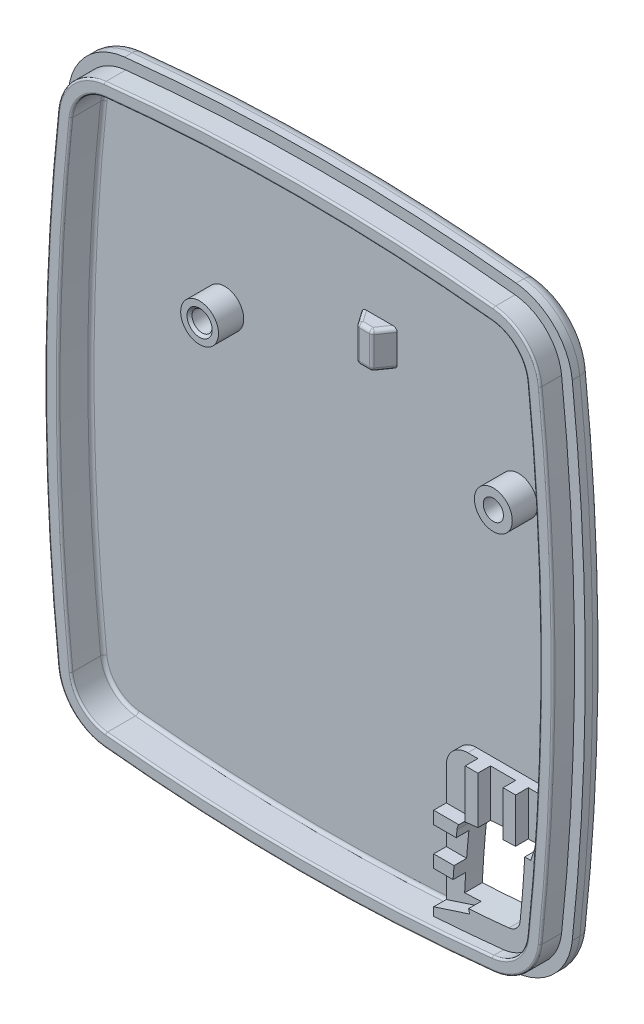
from build123d import *

# Parameters (mm, degrees)
IZIM1_W                           = 42
IZIM1_H                           = 49
Y_KSEKLIK_EKSTR_ZYON1_DEPTH       = 0.8
KES_EKSTR_ZYON1_DEPTH             = 33.308048533
KES_EKSTR_ZYON2_DEPTH             = 33.308048533
RADYUS1_R                         = 5
RADYUS2_R                         = 1
BO_ALTMA1_T                       = -0.7
Y_KSEKLIK_EKSTR_ZYON10_DEPTH      = 1.7
Y_KSEKLIK_EKSTR_ZYON10_DEPTH_BACK = 0.9
KES_EKSTR_ZYON5_DEPTH             = 1.7
RADYUS3_R                         = 0.15
IZIM14_R                          = 1.5
IZIM14_R_2                        = 0.8
Y_KSEKLIK_EKSTR_ZYON13_DEPTH      = 2
RADYUS6_R                         = 0.25
Y_KSEKLIK_EKSTR_ZYON15_DEPTH      = 1.1
Y_KSEKLIK_EKSTR_ZYON15_DEPTH_BACK = 0.2
IZIM17_W                          = 3.777976332
IZIM17_H                          = 2.881557519
Y_KSEKLIK_EKSTR_ZYON16_DEPTH      = 2.4
KES_EKSTR_ZYON3_DEPTH             = 10.4
KES_EKSTR_ZYON3_DEPTH_BACK        = 1.5
Y_KSEKLIK_EKSTR_ZYON18_OUTLINE_W  = 4.462087673
Y_KSEKLIK_EKSTR_ZYON18_OUTLINE_H  = 1.556542211
Y_KSEKLIK_EKSTR_ZYON18_DEPTH      = 0.4
Y_KSEKLIK_EKSTR_ZYON19_START      = -1.435
Y_KSEKLIK_EKSTR_ZYON19_OUTLINE_R  = 0.75
Y_KSEKLIK_EKSTR_ZYON19_DEPTH      = 0.635
RADYUS9_R                         = 0.6
PAH1_SIZE                         = 0.2
PAH2_SIZE                         = 1.9
PAH2_SIZE_2                       = 1.330394323
RADYUS10_R                        = 0.3
RADYUS11_R                        = 1.7
IZIM32_W                          = 3
IZIM32_H                          = 2
IZIM32_W_2                        = 2
IZIM32_H_2                        = 4
IZIM32_W_3                        = 2.812041531
IZIM32_H_3                        = 5.210730246
KES_EKSTR_ZYON6_DEPTH             = 1
Y_KSEKLIK_EKSTR_ZYON22_DEPTH      = 0.1
Y_KSEKLIK_EKSTR_ZYON22_DEPTH_BACK = 0.2
IZIM33_R                          = 4
IZIM34_R                          = 0.763160631
Y_KSEKLIK_EKSTR_ZYON23_DEPTH      = 0.2


# Read off the part's stored shape, not the designer's step: Yükseklik-Ekstrüzyon18, Yükseklik-Ekstrüzyon19
with BuildPart() as part:
    # Çizim1 → Yükseklik-Ekstrüzyon1 (new, symmetric)
    with BuildSketch(Plane.XY):
        Rectangle(IZIM1_W, IZIM1_H)
    extrude(amount=Y_KSEKLIK_EKSTR_ZYON1_DEPTH, both=True)

    # Çizim2 → Kes-Ekstrüzyon1 (cut, through all)
    with BuildSketch(Plane.XY.offset(0.8)):
        with BuildLine():
            Line((21, 24.5), (0, 24.5))
            ThreePointArc((0, 24.5), (10.526751636, 24.1245229), (21, 23))
            Line((21, 23), (21, 24.5))
        make_face()
        with BuildLine():
            Line((0, 24.5), (-21, 24.5))
            Line((-21, 24.5), (-21, 23))
            ThreePointArc((-21, 23), (-10.526751636, 24.1245229), (0, 24.5))
        make_face()
        with BuildLine():
            ThreePointArc((0, -24.5), (-10.526751636, -24.1245229), (-21, -23))
            Line((-21, -23), (-21, -24.5))
            Line((-21, -24.5), (0, -24.5))
        make_face()
        with BuildLine():
            Line((21, -24.5), (21, -23))
            ThreePointArc((21, -23), (10.526751636, -24.1245229), (0, -24.5))
            Line((0, -24.5), (21, -24.5))
        make_face()
    extrude(amount=-KES_EKSTR_ZYON1_DEPTH, mode=Mode.SUBTRACT)

    # Çizim3 → Kes-Ekstrüzyon2 (cut, through all)
    with BuildSketch(Plane.XY.offset(0.8)):
        with BuildLine():
            Line((21, -4.8e-07), (21, 23))
            ThreePointArc((21, 23), (20.250265893, 23.105694222), (19.5, 23.207545043))
            ThreePointArc((19.5, 23.207545043), (20.624609184, 11.627984828), (21, -4.8e-07))
        make_face()
        with BuildLine():
            Line((21, -23), (21, -4.8e-07))
            ThreePointArc((21, -4.8e-07), (20.624609153, -11.627985307), (19.5, -23.207545043))
            ThreePointArc((19.5, -23.207545043), (20.250265893, -23.105694222), (21, -23))
        make_face()
        with BuildLine():
            ThreePointArc((-21, -23), (-20.250265893, -23.105694222), (-19.5, -23.207545043))
            ThreePointArc((-19.5, -23.207545043), (-20.624609193, -11.62798468), (-21, 7.77e-07))
            Line((-21, 7.77e-07), (-21, -23))
        make_face()
        with BuildLine():
            ThreePointArc((-21, 7.77e-07), (-20.624609143, 11.627985455), (-19.5, 23.207545043))
            ThreePointArc((-19.5, 23.207545043), (-20.250265893, 23.105694222), (-21, 23))
            Line((-21, 23), (-21, 7.77e-07))
        make_face()
    extrude(amount=-KES_EKSTR_ZYON2_DEPTH, mode=Mode.SUBTRACT)

    # Radyus1
    radyus1_edges = [part.edges().sort_by_distance(p)[0] for p in [
        (19.5, 23.207545043, 0),
        (19.5, -23.207545043, 0),
        (-19.5, -23.207545043, 0),
        (-19.5, 23.207545043, 0),
    ]]
    fillet(radyus1_edges, radius=RADYUS1_R)

    # Radyus2
    radyus2_edges = [part.edges().sort_by_distance(p)[0] for p in [
        (-21, 0, -0.8),
        (0, -24.5, -0.8),
        (0, 24.5, -0.8),
        (21, 0, -0.8),
        (18.53112444, 22.248381304, -0.8),
        (-18.53112444, 22.248381304, -0.8),
        (18.53112444, -22.248381304, -0.8),
        (-18.53112444, -22.248381304, -0.8),
    ]]
    fillet(radyus2_edges, radius=RADYUS2_R)

    # İç Boşaltma1
    bo_altma1_openings = [part.faces().sort_by_distance(p)[0] for p in [
        (0, 2.1e-08, 0.8),
    ]]
    offset(amount=BO_ALTMA1_T, openings=bo_altma1_openings)



with BuildPart() as body_2:
    # Çizim10 → Yükseklik-Ekstrüzyon10 (new, two sides: drawn at the far end of the back side and taken through both)
    with BuildSketch(Plane.XY.offset(0.8).offset(-Y_KSEKLIK_EKSTR_ZYON10_DEPTH_BACK)):
        with BuildLine():
            ThreePointArc((-19.274000395, -19.168866518), (-18.036566497, -21.752990104), (-15.450363437, -22.986072054))
            ThreePointArc((-15.450363437, -22.986072054), (0, -23.8), (15.450363437, -22.986072054))
            ThreePointArc((15.450363437, -22.986072054), (18.036566497, -21.752990104), (19.274000395, -19.168866518))
            ThreePointArc((19.274000395, -19.168866518), (20.3, 0), (19.274000395, 19.168866518))
            ThreePointArc((19.274000395, 19.168866518), (18.036566497, 21.752990104), (15.450363437, 22.986072054))
            ThreePointArc((15.450363437, 22.986072054), (0, 23.8), (-15.450363437, 22.986072054))
            ThreePointArc((-15.450363437, 22.986072054), (-18.036566497, 21.752990104), (-19.274000395, 19.168866518))
            ThreePointArc((-19.274000395, 19.168866518), (-20.3, 0), (-19.274000395, -19.168866518))
        make_face()
        with BuildLine():
            ThreePointArc((15.324280906, 21.792714104), (0, 22.6), (-15.324280906, 21.792714104))
            ThreePointArc((-15.324280906, 21.792714104), (-17.18875288, 20.903748048), (-18.080856387, 19.04077523))
            ThreePointArc((-18.080856387, 19.04077523), (-19.1, 0), (-18.080856387, -19.04077523))
            ThreePointArc((-18.080856387, -19.04077523), (-17.18875288, -20.903748048), (-15.324280906, -21.792714104))
            ThreePointArc((-15.324280906, -21.792714104), (0, -22.6), (15.324280906, -21.792714104))
            ThreePointArc((15.324280906, -21.792714104), (17.18875288, -20.903748048), (18.080856387, -19.04077523))
            ThreePointArc((18.080856387, -19.04077523), (19.1, 0), (18.080856387, 19.04077523))
            ThreePointArc((18.080856387, 19.04077523), (17.18875288, 20.903748048), (15.324280906, 21.792714104))
        make_face(mode=Mode.SUBTRACT)
    extrude(amount=Y_KSEKLIK_EKSTR_ZYON10_DEPTH + Y_KSEKLIK_EKSTR_ZYON10_DEPTH_BACK)

    # Çizim13 → Kes-Ekstrüzyon5 (cut)
    with BuildSketch(Plane.XY.offset(2.5)):
        with BuildLine():
            ThreePointArc((-19.274000395, 19.168866518), (-20.3, 0), (-19.274000395, -19.168866518))
            ThreePointArc((-19.274000395, -19.168866518), (-18.036566497, -21.752990104), (-15.450363437, -22.986072054))
            ThreePointArc((-15.450363437, -22.986072054), (0, -23.8), (15.450363437, -22.986072054))
            ThreePointArc((15.450363437, -22.986072054), (18.036566497, -21.752990104), (19.274000395, -19.168866518))
            ThreePointArc((19.274000395, -19.168866518), (20.3, 0), (19.274000395, 19.168866518))
            ThreePointArc((19.274000395, 19.168866518), (18.036566497, 21.752990104), (15.450363437, 22.986072054))
            ThreePointArc((15.450363437, 22.986072054), (0, 23.8), (-15.450363437, 22.986072054))
            ThreePointArc((-15.450363437, 22.986072054), (-18.036566497, 21.752990104), (-19.274000395, 19.168866518))
        make_face()
        with BuildLine():
            ThreePointArc((15.434603121, 22.83690231), (0, 23.65), (-15.434603121, 22.83690231))
            ThreePointArc((-15.434603121, 22.83690231), (-17.930589795, 21.646834847), (-19.124857394, 19.152855107))
            ThreePointArc((-19.124857394, 19.152855107), (-20.15, 0), (-19.124857394, -19.152855107))
            ThreePointArc((-19.124857394, -19.152855107), (-17.930589795, -21.646834847), (-15.434603121, -22.83690231))
            ThreePointArc((-15.434603121, -22.83690231), (0, -23.65), (15.434603121, -22.83690231))
            ThreePointArc((15.434603121, -22.83690231), (17.930589795, -21.646834847), (19.124857394, -19.152855107))
            ThreePointArc((19.124857394, -19.152855107), (20.15, 0), (19.124857394, 19.152855107))
            ThreePointArc((19.124857394, 19.152855107), (17.930589795, 21.646834847), (15.434603121, 22.83690231))
        make_face(mode=Mode.SUBTRACT)
    extrude(amount=-KES_EKSTR_ZYON5_DEPTH, mode=Mode.SUBTRACT)

    # Radyus3
    radyus3_edges = [body_2.edges().sort_by_distance(p)[0] for p in [
        (17.18875288, 20.903748048, 2.5),
        (0, 22.6, 2.5),
        (-17.18875288, 20.903748048, 2.5),
        (-19.1, 0, 2.5),
        (-17.18875288, -20.903748048, 2.5),
        (0, -22.6, 2.5),
        (17.18875288, -20.903748048, 2.5),
        (19.1, 0, 2.5),
        (17.930589795, 21.646834847, 2.5),
        (20.15, 0, 2.5),
        (17.930589795, -21.646834847, 2.5),
        (0, -23.65, 2.5),
        (-17.930589795, -21.646834847, 2.5),
        (-20.15, 0, 2.5),
        (-17.930589795, 21.646834847, 2.5),
        (0, 23.65, 2.5),
    ]]
    fillet(radyus3_edges, radius=RADYUS3_R)


with BuildPart() as part_1:
    add(part.part)

    add(body_2.part)  # Yükseklik-Ekstrüzyon13 merges body 2
    # Çizim14 → Yükseklik-Ekstrüzyon13 (add)
    # profile 1 of 2: a face of its own
    with BuildSketch(Plane.XY.offset(-0.1)):
        with Locations(Location((-8.481909678, 9.50887969, 0), (0, 0, 180))):
            Circle(IZIM14_R)
        with Locations((-8.481909678, 9.50887969)):
            Circle(IZIM14_R_2, mode=Mode.SUBTRACT)
    # profile 2 of 2: a face of its own
    with BuildSketch(Plane.XY.offset(-0.1)):
        with Locations(Location((14.811265156, 8.310003034, 0), (0, 0, 180))):
            Circle(IZIM14_R)
        with Locations((14.811265156, 8.310003034)):
            Circle(IZIM14_R_2, mode=Mode.SUBTRACT)
    extrude(amount=Y_KSEKLIK_EKSTR_ZYON13_DEPTH)

    # Radyus6
    radyus6_edges = [part_1.edges().sort_by_distance(p)[0] for p in [
        (19.1, 0, -0.1),
        (17.18875288, 20.903748048, -0.1),
        (0, 22.6, -0.1),
        (-17.18875288, 20.903748048, -0.1),
        (-19.1, 0, -0.1),
        (-17.18875288, -20.903748048, -0.1),
        (0, -22.6, -0.1),
        (17.18875288, -20.903748048, -0.1),
    ]]
    fillet(radyus6_edges, radius=RADYUS6_R)

    # Çizim20 → Yükseklik-Ekstrüzyon16 (add)
    with BuildSketch(Plane(origin=(0, 0, -0.8), x_dir=(-1, 0, 0), z_dir=(0, 0, -1))):
        Polygon((-18.929762461, -10.688381304), (-18.929762461, -16.972393135), (-18.321456915, -20.446835518), (-15.854602823, -22.35), (-9.78112444, -22.421993206), (-9.78112444, -10.688381304), align=None)
    extrude(amount=-Y_KSEKLIK_EKSTR_ZYON16_DEPTH)

    # Çizim11 → Kes-Ekstrüzyon3 (cut, two sides: drawn at the far end of the back side and taken through both)
    with BuildSketch(Plane.XY.offset(-0.1).offset(-KES_EKSTR_ZYON3_DEPTH_BACK)):
        with BuildLine():
            ThreePointArc((15.747267327, -20.08503533), (13.494386991, -20.292748653), (11.236115086, -20.429944269))
            ThreePointArc((11.236115086, -20.429944269), (11.398117376, -17.911625141), (11.631741678, -15.398938201))
            ThreePointArc((11.631741678, -15.398938201), (11.919517003, -14.797979227), (12.520959575, -14.511215983))
            ThreePointArc((12.520959575, -14.511215983), (14.766772487, -14.309259149), (17.017786728, -14.177361138))
            ThreePointArc((17.017786728, -14.177361138), (16.861729506, -16.689033908), (16.634435234, -19.195264399))
            ThreePointArc((16.634435234, -19.195264399), (16.34804685, -19.796885558), (15.747267327, -20.08503533))
        make_face()
    extrude(amount=KES_EKSTR_ZYON3_DEPTH + KES_EKSTR_ZYON3_DEPTH_BACK, mode=Mode.SUBTRACT)

    # Yükseklik-Ekstrüzyon18 outline → Yükseklik-Ekstrüzyon18 (add)
    # profile 1 of 9: a face of its own
    with BuildSketch(Plane(origin=(0, 0, -0.8), x_dir=(-1, 0, 0), z_dir=(0, 0, -1))):
        with BuildLine():
            add(Edge.make_bspline(
                [(12.118367005, -9.482808521), (12.091880497, -9.48291382), (12.041867707, -9.48311265), (11.970803059, -9.485904145), (11.90831427, -9.488622522), (11.853948015, -9.493540095), (11.808151869, -9.499658497), (11.770372058, -9.507510039), (11.740978928, -9.517024279), (11.712578237, -9.530538402), (11.686317962, -9.555004828), (11.666544013, -9.593198708), (11.652900211, -9.63890303), (11.651926387, -9.672393805), (11.651404341, -9.690347482)],
                knots=[0, 0, 0, 0, 0.135204718, 0.255298483, 0.3630462, 0.45447317, 0.533879273, 0.598821629, 0.651172559, 0.691275066, 0.758648293, 0.82966591, 0.908687594, 1, 1, 1, 1], degree=3))
            Line((12.118367005, -9.482808521), (13.623024476, -9.482808521))
            Line((13.623024476, -9.482808521), (13.623024476, -8.03003579))
            Line((13.623024476, -8.03003579), (12.419136359, -8.03003579))
            add(Edge.make_bspline(
                [(11.314964228, -8.788039419), (11.317062174, -8.75801293), (11.321118336, -8.699959799), (11.332397364, -8.61654582), (11.34780333, -8.539908247), (11.366699794, -8.469939251), (11.391285928, -8.407078258), (11.419641216, -8.350796065), (11.451733054, -8.300806663), (11.500226471, -8.246113688), (11.562419933, -8.190013261), (11.633993622, -8.133335083), (11.701789418, -8.091147069), (11.759689265, -8.068191793), (11.810748879, -8.056202575), (11.86066885, -8.049293804), (11.922964144, -8.044341352), (11.997757372, -8.038133057), (12.085368812, -8.034439426), (12.185645657, -8.032272406), (12.298337357, -8.03060783), (12.377519873, -8.030232863), (12.419136359, -8.03003579)],
                knots=[0, 0, 0, 0, 0.057749972, 0.111653638, 0.161384845, 0.207685759, 0.250539078, 0.290660311, 0.328487367, 0.364148125, 0.430567385, 0.488965629, 0.539213259, 0.583221344, 0.607748032, 0.639723137, 0.679817551, 0.727663726, 0.783729083, 0.848050361, 0.920138808, 1, 1, 1, 1], degree=3))
            add(Edge.make_bspline(
                [(10.39968498, -8.03003579), (10.440773487, -8.030408375), (10.519795704, -8.03112494), (10.63350644, -8.039166316), (10.737167124, -8.052863048), (10.831106831, -8.071002989), (10.914883838, -8.095367676), (10.989349707, -8.124212349), (11.054119041, -8.158744508), (11.108967073, -8.200458649), (11.156101222, -8.248145875), (11.195756356, -8.303608511), (11.231331966, -8.365411153), (11.258847184, -8.435943945), (11.282859633, -8.512980977), (11.299309701, -8.598095345), (11.310768625, -8.690469813), (11.313533397, -8.754765146), (11.314964228, -8.788039419)],
                knots=[0, 0, 0, 0, 0.089184998, 0.171522325, 0.247270212, 0.316068583, 0.379002164, 0.436410953, 0.489174977, 0.537748439, 0.58545333, 0.634147084, 0.685372273, 0.739840404, 0.798108953, 0.860349726, 0.927727859, 1, 1, 1, 1], degree=3))
            add(Edge.make_bspline(
                [(9.160936803, -10.224598168), (9.16102192, -10.14622951), (9.161185412, -9.995699972), (9.164367327, -9.779223143), (9.17006806, -9.581402536), (9.177392544, -9.402500776), (9.185483166, -9.242669918), (9.197973132, -9.101883377), (9.211505704, -8.979953432), (9.226265955, -8.873856856), (9.247412743, -8.779719274), (9.272634382, -8.691716217), (9.306479387, -8.609109055), (9.345195666, -8.53025376), (9.391966543, -8.456758077), (9.443604586, -8.386531754), (9.502433, -8.321580214), (9.5674802, -8.260836609), (9.640896268, -8.206531127), (9.722445144, -8.157904648), (9.813989746, -8.118614126), (9.914048869, -8.086673622), (10.022541054, -8.060076957), (10.140399524, -8.0433963), (10.267016795, -8.031234422), (10.354523141, -8.030443819), (10.39968498, -8.03003579)],
                knots=[0, 0, 0, 0, 0.079725817, 0.153136352, 0.220243204, 0.281049773, 0.335292386, 0.383031116, 0.424805529, 0.460108295, 0.491924878, 0.522891582, 0.553113479, 0.582620451, 0.612140226, 0.641611317, 0.671200139, 0.701159565, 0.732005221, 0.763924969, 0.797533254, 0.833090932, 0.870698054, 0.911016939, 0.954076031, 1, 1, 1, 1], degree=3))
            Line((9.160936803, -10.224598168), (9.160936803, -11.246889694))
            Line((9.160936803, -11.246889694), (13.623024476, -11.246889694))
            Line((13.623024476, -11.246889694), (13.623024476, -9.690347482))
            Line((13.623024476, -9.690347482), (11.651404341, -9.690347482))
        make_face()
        with BuildLine():
            add(Edge.make_bspline(
                [(10.281322916, -9.482808521), (10.252890403, -9.483457227), (10.201690983, -9.484625375), (10.132772311, -9.49551634), (10.07932982, -9.513206842), (10.04205633, -9.541992902), (10.019671149, -9.576122033), (10.002791352, -9.61151538), (9.992897811, -9.650097278), (9.991701049, -9.676781819), (9.991092649, -9.690347482)],
                knots=[0, 0, 0, 0, 0.207755591, 0.374112754, 0.509202691, 0.614768302, 0.711267723, 0.804995066, 0.900865026, 1, 1, 1, 1], degree=3))
            Line((10.281322916, -9.482808521), (10.525343335, -9.482808521))
            add(Edge.make_bspline(
                [(10.873133236, -9.690347482), (10.871018555, -9.664222954), (10.866911237, -9.613481602), (10.844355334, -9.558396387), (10.817560429, -9.528737079), (10.795758621, -9.516263115), (10.76747295, -9.505968169), (10.732453243, -9.497070431), (10.690312725, -9.491168265), (10.641361666, -9.486339131), (10.585650171, -9.482985998), (10.546156504, -9.482869772), (10.525343335, -9.482808521)],
                knots=[0, 0, 0, 0, 0.166092219, 0.322598885, 0.365047389, 0.417388159, 0.479796133, 0.555892735, 0.646094533, 0.749476332, 0.867973991, 1, 1, 1, 1], degree=3))
            Line((10.873133236, -9.690347482), (9.991092649, -9.690347482))
        make_face(mode=Mode.SUBTRACT)
    # profile 2 of 9: a face of its own
    with BuildSketch(Plane(origin=(0, 0, -0.8), x_dir=(-1, 0, 0), z_dir=(0, 0, -1))):
        with BuildLine():
            add(Edge.make_bspline(
                [(9.057167322, -4.246154217), (9.058794881, -4.174214953), (9.061972731, -4.033751699), (9.084727917, -3.82810577), (9.123605114, -3.633091274), (9.177259337, -3.449336151), (9.246150074, -3.279340213), (9.331884624, -3.126914738), (9.430773225, -2.991060154), (9.545672045, -2.876394153), (9.668807183, -2.781073251), (9.797565761, -2.705889353), (9.930608523, -2.651872362), (10.047760097, -2.626951796), (10.148276192, -2.616036395), (10.236115954, -2.607870573), (10.336377205, -2.600587666), (10.448825213, -2.595040181), (10.573431172, -2.591302336), (10.710435192, -2.587790656), (10.859889801, -2.586519799), (10.963661392, -2.586073701), (11.01743767, -2.585842525)],
                knots=[0, 0, 0, 0, 0.071156086, 0.138934077, 0.204360269, 0.267628769, 0.328042607, 0.385371601, 0.440225967, 0.493719081, 0.545369064, 0.59387776, 0.640786826, 0.686772042, 0.711805655, 0.740799195, 0.77403348, 0.811237386, 0.852158453, 0.897347383, 0.946803594, 1, 1, 1, 1], degree=3))
            add(Edge.make_bspline(
                [(11.01743767, -5.854581169), (10.96393053, -5.85439323), (10.860697281, -5.854030633), (10.712073473, -5.852185362), (10.575287493, -5.850578536), (10.45076099, -5.84481203), (10.338001896, -5.840768517), (10.237226272, -5.833914774), (10.148499129, -5.827090941), (10.046507317, -5.815652242), (9.928237128, -5.791875793), (9.794007293, -5.740475071), (9.665576791, -5.668747355), (9.54322794, -5.578068126), (9.430591777, -5.468032414), (9.331988531, -5.339092826), (9.247304429, -5.193676619), (9.177864525, -5.031596605), (9.123934819, -4.854251543), (9.085555601, -4.663112247), (9.061653942, -4.458890273), (9.058690448, -4.318374247), (9.057167322, -4.246154217)],
                knots=[0, 0, 0, 0, 0.053608009, 0.103427861, 0.148920116, 0.190646336, 0.228314806, 0.261956867, 0.291838231, 0.317461837, 0.364773927, 0.412243015, 0.460839878, 0.511740483, 0.564390982, 0.618057073, 0.673872393, 0.732566435, 0.794313299, 0.859251815, 0.92766065, 1, 1, 1, 1], degree=3))
            Line((11.01743767, -5.854581169), (11.766523609, -5.854581169))
            add(Edge.make_bspline(
                [(13.726793957, -4.246154217), (13.725427858, -4.315389373), (13.722752558, -4.450976079), (13.700827, -4.649021797), (13.663519017, -4.836434329), (13.612093138, -5.012231463), (13.546521097, -5.175435679), (13.463117367, -5.322235446), (13.365403152, -5.453634555), (13.252933191, -5.566498186), (13.130743791, -5.660804348), (13.001920323, -5.734456804), (12.868012333, -5.787603552), (12.750329866, -5.813591692), (12.648381874, -5.824397243), (12.559461893, -5.832507904), (12.45812258, -5.839837736), (12.344324862, -5.845418221), (12.21782576, -5.849111313), (12.078660171, -5.852624752), (11.926773823, -5.853910905), (11.821380829, -5.854351723), (11.766523609, -5.854581169)],
                knots=[0, 0, 0, 0, 0.069361909, 0.135834932, 0.199347161, 0.260608178, 0.319138762, 0.3751603, 0.429315834, 0.482735953, 0.534295463, 0.583532345, 0.630949374, 0.67811757, 0.703744355, 0.733652727, 0.767587554, 0.805543785, 0.847806793, 0.894393145, 0.945031466, 1, 1, 1, 1], degree=3))
            add(Edge.make_bspline(
                [(11.766523609, -2.585842525), (11.819219585, -2.586042329), (11.920830577, -2.5864276), (12.067298825, -2.588115462), (12.201892513, -2.590260114), (12.324600697, -2.594213816), (12.435662084, -2.600006051), (12.53512249, -2.606387215), (12.622759642, -2.613383674), (12.723670325, -2.624805652), (12.841162352, -2.648530495), (12.975090201, -2.700255944), (13.104073121, -2.772413308), (13.226969204, -2.865134973), (13.341923116, -2.976859684), (13.442500573, -3.109446462), (13.528743134, -3.260345828), (13.600616183, -3.428489225), (13.656659998, -3.612922199), (13.698078157, -3.811440857), (13.722440586, -4.024225494), (13.725313742, -4.170694925), (13.726793957, -4.246154217)],
                knots=[0, 0, 0, 0, 0.052107752, 0.100476752, 0.144841806, 0.185213496, 0.221869806, 0.254806787, 0.283766119, 0.308790412, 0.355224479, 0.401825094, 0.450152003, 0.500922991, 0.553643104, 0.608157733, 0.664900664, 0.725110244, 0.788586777, 0.855196428, 0.925398939, 1, 1, 1, 1], degree=3))
            Line((11.766523609, -2.585842525), (11.01743767, -2.585842525))
        make_face()
        with BuildLine():
            add(Edge.make_bspline(
                [(10.316182975, -4.142384737), (10.292400075, -4.142209018), (10.247529948, -4.141877497), (10.183770238, -4.144073992), (10.127266957, -4.145296381), (10.078074466, -4.147720205), (10.036134268, -4.150759589), (10.001879944, -4.155052587), (9.974277665, -4.158375113), (9.948818553, -4.165680505), (9.924490968, -4.176078587), (9.902914577, -4.193479969), (9.88939765, -4.216006875), (9.888024973, -4.232736644), (9.887323168, -4.241290023)],
                knots=[0, 0, 0, 0, 0.150823581, 0.284552058, 0.40457432, 0.509248844, 0.5969264, 0.671120842, 0.728325207, 0.772820751, 0.838778239, 0.894736625, 0.946182312, 1, 1, 1, 1], degree=3))
            Line((10.316182975, -4.142384737), (12.350226939, -4.142384737))
            add(Edge.make_bspline(
                [(12.896638111, -4.248586314), (12.895839192, -4.238882557), (12.894260269, -4.219704771), (12.876968515, -4.194576015), (12.849607834, -4.176516331), (12.819740395, -4.165580928), (12.787736288, -4.158298633), (12.753157315, -4.155101517), (12.709442354, -4.150671608), (12.655883458, -4.147760173), (12.592914909, -4.145294146), (12.520472748, -4.144057622), (12.43860381, -4.141883671), (12.380765109, -4.142211596), (12.350226939, -4.142384737)],
                knots=[0, 0, 0, 0, 0.048585199, 0.096020173, 0.148029396, 0.212566793, 0.256048555, 0.313918305, 0.388116605, 0.47858284, 0.585380571, 0.707180231, 0.84539452, 1, 1, 1, 1], degree=3))
            add(Edge.make_bspline(
                [(12.382654901, -4.298038958), (12.413191521, -4.298104734), (12.47102327, -4.298229304), (12.552637521, -4.297406255), (12.62399424, -4.295988741), (12.685050027, -4.293288229), (12.736161329, -4.291165726), (12.777283887, -4.288187098), (12.808407461, -4.284191263), (12.835318257, -4.279187337), (12.858923172, -4.272367114), (12.877526776, -4.262107065), (12.892147557, -4.257492556), (12.895457007, -4.250928832), (12.896638111, -4.248586314)],
                knots=[0, 0, 0, 0, 0.175019535, 0.331460592, 0.467794188, 0.58405049, 0.681738322, 0.760972023, 0.820335453, 0.861343311, 0.918167156, 0.959057849, 0.985388221, 1, 1, 1, 1], degree=3))
            Line((12.382654901, -4.298038958), (10.316182975, -4.298038958))
            add(Edge.make_bspline(
                [(9.887323168, -4.241290023), (9.888084427, -4.242424334), (9.890830804, -4.246516568), (9.900757498, -4.250778542), (9.914130766, -4.260429435), (9.929954352, -4.271063524), (9.950517881, -4.279345634), (9.976203444, -4.283011992), (10.01040172, -4.288314346), (10.053724042, -4.292143564), (10.106478524, -4.294001994), (10.168066844, -4.297011604), (10.239170175, -4.297118107), (10.289431284, -4.297719085), (10.316182975, -4.298038958)],
                knots=[0, 0, 0, 0, 0.009199604, 0.033189236, 0.070444793, 0.122518127, 0.162151234, 0.220247298, 0.298308526, 0.398089248, 0.515973477, 0.657754866, 0.817838549, 1, 1, 1, 1], degree=3))
        make_face(mode=Mode.SUBTRACT)
    # profile 3 of 9: a face of its own
    with BuildSketch(Plane(origin=(0, 0, -0.8), x_dir=(-1, 0, 0), z_dir=(0, 0, -1))):
        with BuildLine():
            add(Edge.make_bspline(
                [(9.160936803, -0.380971898), (9.238253616, -0.366263245), (9.395956951, -0.33626196), (9.636647883, -0.287419943), (9.887244369, -0.239801171), (10.057062969, -0.205490398), (10.143504074, -0.18802552)],
                knots=[0, 0, 0, 0, 0.23579309, 0.48094787, 0.735791961, 1, 1, 1, 1], degree=3))
            Line((9.160936803, -0.380971898), (9.160936803, -2.27638632))
            Line((9.160936803, -2.27638632), (13.623024476, -2.27638632))
            Line((13.623024476, -2.27638632), (13.623024476, -0.929815168))
            Line((13.623024476, -0.929815168), (10.732882297, -0.911979788))
            Line((10.732882297, -0.911979788), (13.623024476, -0.609589035))
            Line((13.623024476, -0.609589035), (13.623024476, 0.46539793))
            Line((13.623024476, 0.46539793), (10.680997556, 0.767788682))
            Line((10.680997556, 0.767788682), (13.623024476, 0.785624062))
            Line((13.623024476, 0.785624062), (13.623024476, 2.133816613))
            Line((13.623024476, 2.133816613), (9.160936803, 2.133816613))
            Line((9.160936803, 2.133816613), (9.160936803, 0.234348695))
            Line((9.160936803, 0.234348695), (11.195791465, -0.052638775))
            Line((11.195791465, -0.052638775), (10.143504074, -0.18802552))
        make_face()
    # profile 4 of 9: a face of its own
    with BuildSketch(Plane(origin=(0, 0, -0.8), x_dir=(-1, 0, 0), z_dir=(0, 0, -1))):
        with BuildLine():
            add(Edge.make_bspline(
                [(9.057167322, 4.10358451), (9.058794881, 4.175523774), (9.061972731, 4.315987028), (9.084727917, 4.521632956), (9.123605114, 4.716647453), (9.177259337, 4.900402576), (9.246150074, 5.070398514), (9.331884624, 5.222823989), (9.430773225, 5.358678573), (9.545672045, 5.473344574), (9.668807183, 5.568665476), (9.797565761, 5.643849374), (9.930608523, 5.697866365), (10.047760097, 5.722786931), (10.148276192, 5.733702332), (10.236115954, 5.741868154), (10.336377205, 5.749151061), (10.448825213, 5.754698546), (10.573431172, 5.758436391), (10.710435192, 5.76194807), (10.859889801, 5.763218928), (10.963661392, 5.763665026), (11.01743767, 5.763896202)],
                knots=[0, 0, 0, 0, 0.071156086, 0.138934077, 0.204360269, 0.267628769, 0.328042607, 0.385371601, 0.440225967, 0.493719081, 0.545369064, 0.59387776, 0.640786826, 0.686772042, 0.711805655, 0.740799195, 0.77403348, 0.811237386, 0.852158453, 0.897347383, 0.946803594, 1, 1, 1, 1], degree=3))
            add(Edge.make_bspline(
                [(11.01743767, 2.495157557), (10.96393053, 2.495345496), (10.860697281, 2.495708094), (10.712073473, 2.497553365), (10.575287493, 2.499160191), (10.45076099, 2.504926697), (10.338001896, 2.508970209), (10.237226272, 2.515823953), (10.148499129, 2.522647786), (10.046507317, 2.534086485), (9.928237128, 2.557862933), (9.794007293, 2.609263655), (9.665576791, 2.680991372), (9.54322794, 2.7716706), (9.430591777, 2.881706313), (9.331988531, 3.010645901), (9.247304429, 3.156062108), (9.177864525, 3.318142122), (9.123934819, 3.495487184), (9.085555601, 3.68662648), (9.061653942, 3.890848453), (9.058690448, 4.03136448), (9.057167322, 4.10358451)],
                knots=[0, 0, 0, 0, 0.053608009, 0.103427861, 0.148920116, 0.190646336, 0.228314806, 0.261956867, 0.291838231, 0.317461837, 0.364773927, 0.412243015, 0.460839878, 0.511740483, 0.564390982, 0.618057073, 0.673872393, 0.732566435, 0.794313299, 0.859251815, 0.92766065, 1, 1, 1, 1], degree=3))
            Line((11.01743767, 2.495157557), (11.766523609, 2.495157557))
            add(Edge.make_bspline(
                [(13.726793957, 4.10358451), (13.725427858, 4.034349353), (13.722752558, 3.898762648), (13.700827, 3.70071693), (13.663519017, 3.513304398), (13.612093138, 3.337507264), (13.546521097, 3.174303048), (13.463117367, 3.02750328), (13.365403152, 2.896104172), (13.252933191, 2.783240541), (13.130743791, 2.688934378), (13.001920323, 2.615281923), (12.868012333, 2.562135175), (12.750329866, 2.536147035), (12.648381874, 2.525341483), (12.559461893, 2.517230823), (12.45812258, 2.509900991), (12.344324862, 2.504320506), (12.21782576, 2.500627414), (12.078660171, 2.497113975), (11.926773823, 2.495827821), (11.821380829, 2.495387004), (11.766523609, 2.495157557)],
                knots=[0, 0, 0, 0, 0.069361909, 0.135834932, 0.199347161, 0.260608178, 0.319138762, 0.3751603, 0.429315834, 0.482735953, 0.534295463, 0.583532345, 0.630949374, 0.67811757, 0.703744355, 0.733652727, 0.767587554, 0.805543785, 0.847806793, 0.894393145, 0.945031466, 1, 1, 1, 1], degree=3))
            add(Edge.make_bspline(
                [(11.766523609, 5.763896202), (11.819219585, 5.763696398), (11.920830577, 5.763311127), (12.067298825, 5.761623264), (12.201892513, 5.759478613), (12.324600697, 5.755524911), (12.435662084, 5.749732676), (12.53512249, 5.743351512), (12.622759642, 5.736355052), (12.723670325, 5.724933075), (12.841162352, 5.701208232), (12.975090201, 5.649482782), (13.104073121, 5.577325419), (13.226969204, 5.484603753), (13.341923116, 5.372879042), (13.442500573, 5.240292265), (13.528743134, 5.089392899), (13.600616183, 4.921249502), (13.656659998, 4.736816528), (13.698078157, 4.53829787), (13.722440586, 4.325513233), (13.725313742, 4.179043802), (13.726793957, 4.10358451)],
                knots=[0, 0, 0, 0, 0.052107752, 0.100476752, 0.144841806, 0.185213496, 0.221869806, 0.254806787, 0.283766119, 0.308790412, 0.355224479, 0.401825094, 0.450152003, 0.500922991, 0.553643104, 0.608157733, 0.664900664, 0.725110244, 0.788586777, 0.855196428, 0.925398939, 1, 1, 1, 1], degree=3))
            Line((11.766523609, 5.763896202), (11.01743767, 5.763896202))
        make_face()
        with BuildLine():
            add(Edge.make_bspline(
                [(10.316182975, 4.20735399), (10.292400075, 4.207529709), (10.247529948, 4.20786123), (10.183770238, 4.205664735), (10.127266957, 4.204442346), (10.078074466, 4.202018522), (10.036134268, 4.198979138), (10.001879944, 4.19468614), (9.974277665, 4.191363614), (9.948818553, 4.184058222), (9.924490968, 4.17366014), (9.902914577, 4.156258758), (9.88939765, 4.133731851), (9.888024973, 4.117002082), (9.887323168, 4.108448704)],
                knots=[0, 0, 0, 0, 0.150823581, 0.284552058, 0.40457432, 0.509248844, 0.5969264, 0.671120842, 0.728325207, 0.772820751, 0.838778239, 0.894736625, 0.946182312, 1, 1, 1, 1], degree=3))
            Line((10.316182975, 4.20735399), (12.350226939, 4.20735399))
            add(Edge.make_bspline(
                [(12.896638111, 4.101152412), (12.895839192, 4.11085617), (12.894260269, 4.130033956), (12.876968515, 4.155162712), (12.849607834, 4.173222395), (12.819740395, 4.184157799), (12.787736288, 4.191440094), (12.753157315, 4.19463721), (12.709442354, 4.199067119), (12.655883458, 4.201978553), (12.592914909, 4.204444581), (12.520472748, 4.205681105), (12.43860381, 4.207855056), (12.380765109, 4.207527131), (12.350226939, 4.20735399)],
                knots=[0, 0, 0, 0, 0.048585199, 0.096020173, 0.148029396, 0.212566793, 0.256048555, 0.313918305, 0.388116605, 0.47858284, 0.585380571, 0.707180231, 0.84539452, 1, 1, 1, 1], degree=3))
            add(Edge.make_bspline(
                [(12.382654901, 4.051699769), (12.413191521, 4.051633993), (12.47102327, 4.051509423), (12.552637521, 4.052332472), (12.62399424, 4.053749986), (12.685050027, 4.056450498), (12.736161329, 4.058573001), (12.777283887, 4.061551629), (12.808407461, 4.065547463), (12.835318257, 4.070551389), (12.858923172, 4.077371613), (12.877526776, 4.087631662), (12.892147557, 4.09224617), (12.895457007, 4.098809895), (12.896638111, 4.101152412)],
                knots=[0, 0, 0, 0, 0.175019535, 0.331460592, 0.467794188, 0.58405049, 0.681738322, 0.760972023, 0.820335453, 0.861343311, 0.918167156, 0.959057849, 0.985388221, 1, 1, 1, 1], degree=3))
            Line((12.382654901, 4.051699769), (10.316182975, 4.051699769))
            add(Edge.make_bspline(
                [(9.887323168, 4.108448704), (9.888084427, 4.107314392), (9.890830804, 4.103222159), (9.900757498, 4.098960185), (9.914130766, 4.089309292), (9.929954352, 4.078675203), (9.950517881, 4.070393093), (9.976203444, 4.066726735), (10.01040172, 4.061424381), (10.053724042, 4.057595163), (10.106478524, 4.055736732), (10.168066844, 4.052727122), (10.239170175, 4.05262062), (10.289431284, 4.052019642), (10.316182975, 4.051699769)],
                knots=[0, 0, 0, 0, 0.009199604, 0.033189236, 0.070444793, 0.122518127, 0.162151234, 0.220247298, 0.298308526, 0.398089248, 0.515973477, 0.657754866, 0.817838549, 1, 1, 1, 1], degree=3))
        make_face(mode=Mode.SUBTRACT)
    # profile 5 of 9: a face of its own
    with BuildSketch(Plane(origin=(0, 0, -0.8), x_dir=(-1, 0, 0), z_dir=(0, 0, -1))):
        with BuildLine():
            add(Edge.make_bspline(
                [(12.544794715, 9.445860532), (12.580740095, 9.445265962), (12.65024328, 9.444116316), (12.751214021, 9.438920813), (12.845351952, 9.428231911), (12.933087188, 9.413851778), (13.014094448, 9.395360963), (13.088617431, 9.372984129), (13.155797568, 9.345034696), (13.217622974, 9.314497823), (13.273208356, 9.278063909), (13.324831199, 9.237706741), (13.371212974, 9.190821127), (13.413435696, 9.139036041), (13.45064768, 9.081705005), (13.484370682, 9.019889774), (13.512379254, 8.952027813), (13.537529847, 8.877459451), (13.557823125, 8.791124985), (13.575125412, 8.689837164), (13.59050428, 8.571396598), (13.602067253, 8.435588558), (13.611964794, 8.28234682), (13.617886176, 8.111486744), (13.622043586, 7.923388179), (13.62268823, 7.792307372), (13.623024476, 7.72393571)],
                knots=[0, 0, 0, 0, 0.04482262, 0.08666802, 0.12599616, 0.162886147, 0.197458482, 0.229537351, 0.259757609, 0.288085492, 0.315374457, 0.342473486, 0.369633187, 0.397416857, 0.425638346, 0.454733269, 0.485082846, 0.517046499, 0.552757527, 0.595520652, 0.645126711, 0.701619949, 0.765427277, 0.836569843, 0.914754938, 1, 1, 1, 1], degree=3))
            Line((12.544794715, 9.445860532), (12.139445181, 9.445860532))
            add(Edge.make_bspline(
                [(11.210384048, 8.612461889), (11.215077986, 8.649280784), (11.224129325, 8.72027882), (11.244389751, 8.822194891), (11.269994241, 8.915564767), (11.301603799, 9.000571736), (11.33899941, 9.077042607), (11.381144559, 9.145841732), (11.428905763, 9.206479271), (11.483586448, 9.258004584), (11.543194453, 9.303238802), (11.609627558, 9.341279836), (11.682375049, 9.373920008), (11.761432613, 9.400318558), (11.846917584, 9.420661289), (11.938543221, 9.434928553), (12.036847548, 9.443971737), (12.104564637, 9.44521839), (12.139445181, 9.445860532)],
                knots=[0, 0, 0, 0, 0.078804769, 0.151959578, 0.220462389, 0.284203699, 0.3442606, 0.400955123, 0.455267335, 0.507628382, 0.560080549, 0.613822818, 0.669818879, 0.729161399, 0.790544411, 0.856209688, 0.925934733, 1, 1, 1, 1], degree=3))
            add(Edge.make_bspline(
                [(10.449137623, 9.342091051), (10.480235758, 9.341744302), (10.540115743, 9.34107663), (10.626494767, 9.332635911), (10.705914134, 9.319976383), (10.778816132, 9.302438442), (10.844711186, 9.278756255), (10.904565729, 9.250559167), (10.957548463, 9.216562883), (11.003716993, 9.176597459), (11.045458553, 9.131493166), (11.080381751, 9.077890836), (11.11348041, 9.018364594), (11.141399221, 8.95113055), (11.164875748, 8.876724369), (11.18394603, 8.795066293), (11.200561264, 8.70642274), (11.207043973, 8.644411718), (11.210384048, 8.612461889)],
                knots=[0, 0, 0, 0, 0.077428666, 0.149090205, 0.215923776, 0.277629446, 0.335536404, 0.390025479, 0.442112961, 0.491755692, 0.541784753, 0.5946149, 0.650641142, 0.711269208, 0.775552964, 0.844770627, 0.920021444, 1, 1, 1, 1], degree=3))
            add(Edge.make_bspline(
                [(9.160936803, 7.501804165), (9.161311208, 7.556122734), (9.162037771, 7.661532314), (9.165822915, 7.814805638), (9.173238206, 7.958320167), (9.182916662, 8.092390463), (9.194706533, 8.217085992), (9.209921204, 8.332324931), (9.228617114, 8.43775653), (9.249679001, 8.534724484), (9.274388717, 8.625060689), (9.306438367, 8.709327763), (9.34317784, 8.78954396), (9.384764886, 8.865620368), (9.433316639, 8.936590828), (9.486651283, 9.003328421), (9.546439712, 9.065050507), (9.611282891, 9.123176734), (9.683953623, 9.176037011), (9.766683008, 9.220124651), (9.857761509, 9.258498904), (9.958398406, 9.288926279), (10.067850725, 9.313283202), (10.186882995, 9.329712734), (10.314897457, 9.340625774), (10.403443631, 9.341592286), (10.449137623, 9.342091051)],
                knots=[0, 0, 0, 0, 0.062133536, 0.120575155, 0.175357735, 0.226495057, 0.274322775, 0.318607107, 0.359415054, 0.396764567, 0.432090752, 0.466423874, 0.49975728, 0.532962887, 0.565455875, 0.597992942, 0.630566695, 0.663629561, 0.697514488, 0.73306311, 0.770607814, 0.810401034, 0.853148388, 0.898742422, 0.947746326, 1, 1, 1, 1], degree=3))
            Line((9.160936803, 7.501804165), (9.160936803, 6.073352406))
            Line((9.160936803, 6.073352406), (13.623024476, 6.073352406))
            Line((13.623024476, 6.073352406), (13.623024476, 7.72393571))
        make_face()
        with BuildLine():
            add(Edge.make_bspline(
                [(10.360771424, 7.88931832), (10.331023967, 7.888899738), (10.276581517, 7.888133667), (10.202659503, 7.881717719), (10.143710859, 7.872712557), (10.099252523, 7.856739402), (10.066218579, 7.837601442), (10.04156271, 7.815903861), (10.021596843, 7.793036797), (10.005287183, 7.755952116), (9.995847223, 7.70086462), (9.992777733, 7.65504733), (9.991092649, 7.629894618)],
                knots=[0, 0, 0, 0, 0.167617016, 0.306765069, 0.418210582, 0.50254002, 0.57150695, 0.631977243, 0.687171809, 0.741004388, 0.857816951, 1, 1, 1, 1], degree=3))
            add(Edge.make_bspline(
                [(10.870701138, 7.652594192), (10.870072181, 7.676418349), (10.868932383, 7.719592549), (10.857741816, 7.777535841), (10.837531576, 7.821357662), (10.811758029, 7.848732744), (10.782009089, 7.859938718), (10.750774011, 7.867781471), (10.709831073, 7.874778506), (10.658950735, 7.880348213), (10.598334454, 7.883919446), (10.527811891, 7.887424281), (10.447519446, 7.888653751), (10.390766892, 7.889088527), (10.360771424, 7.88931832)],
                knots=[0, 0, 0, 0, 0.107580107, 0.19495695, 0.264280627, 0.323837119, 0.358294207, 0.406253532, 0.469462515, 0.545616321, 0.637359468, 0.743657985, 0.864515375, 1, 1, 1, 1], degree=3))
            add(Edge.make_bspline(
                [(10.870923494, 7.629894618), (10.871064609, 7.631256718), (10.872515265, 7.638614366), (10.871517315, 7.646304664), (10.870701138, 7.652594192)],
                knots=[0.392203083, 0.392203083, 0.392203083, 0.392203083, 0.50291196, 1, 1, 1, 1], degree=3))
            Line((10.870923494, 7.629894618), (9.991092649, 7.629894618))
        make_face(mode=Mode.SUBTRACT)
        with BuildLine():
            add(Edge.make_bspline(
                [(12.014597524, 7.88931832), (11.99378733, 7.889182195), (11.954582976, 7.888925748), (11.899141975, 7.886542396), (11.850460388, 7.882564148), (11.808416661, 7.877307306), (11.773337026, 7.869717176), (11.744385785, 7.862330169), (11.722046842, 7.85192965), (11.699980336, 7.834923086), (11.682020733, 7.803293911), (11.665988591, 7.757262937), (11.656432382, 7.697747031), (11.653188113, 7.653966269), (11.651404341, 7.629894618)],
                knots=[0, 0, 0, 0, 0.116332655, 0.219159248, 0.310114608, 0.389378867, 0.455745983, 0.510735795, 0.556006, 0.592575844, 0.664646823, 0.754478689, 0.865006843, 1, 1, 1, 1], degree=3))
            Line((12.014597524, 7.88931832), (12.429675447, 7.88931832))
            add(Edge.make_bspline(
                [(12.79286863, 7.629894618), (12.79124606, 7.652115076), (12.788252108, 7.69311608), (12.776363856, 7.749568369), (12.758229355, 7.795483084), (12.736958116, 7.826887379), (12.714328307, 7.846331805), (12.691082321, 7.85831376), (12.661879512, 7.867328339), (12.626979621, 7.875743588), (12.586263156, 7.881656332), (12.539509597, 7.886828424), (12.486711124, 7.888833223), (12.449402271, 7.889150541), (12.429675447, 7.88931832)],
                knots=[0, 0, 0, 0, 0.126689095, 0.233765655, 0.326856144, 0.406222315, 0.446584803, 0.495429104, 0.553780274, 0.620168531, 0.699549597, 0.78768208, 0.88773822, 1, 1, 1, 1], degree=3))
            Line((12.79286863, 7.629894618), (11.651404341, 7.629894618))
        make_face(mode=Mode.SUBTRACT)
    # profile 6 of 9: a face of its own
    with BuildSketch(Plane(origin=(0, 0, -0.8), x_dir=(-1, 0, 0), z_dir=(0, 0, -1))):
        Polygon((10.14674687, -11.348806937), (9.160936803, -11.348806937), (9.160936803, -14.46189136), (10.14674687, -14.46189136), (10.14674687, -13.683620254), (13.623024476, -13.683620254), (13.623024476, -12.127078043), (10.14674687, -12.127078043), align=None)
    # profile 7 of 9: a face of its own
    with BuildSketch(Plane(origin=(0, 0, -0.8), x_dir=(-1, 0, 0), z_dir=(0, 0, -1))):
        with Locations((11.39198064, -6.94230848)):
            Rectangle(Y_KSEKLIK_EKSTR_ZYON18_OUTLINE_W, Y_KSEKLIK_EKSTR_ZYON18_OUTLINE_H)
    # profile 8 of 9: a face of its own
    with BuildSketch(Plane(origin=(0, 0, -0.8), x_dir=(-1, 0, 0), z_dir=(0, 0, -1))):
        with Locations((11.39198064, 10.481703102)):
            Rectangle(Y_KSEKLIK_EKSTR_ZYON18_OUTLINE_W, Y_KSEKLIK_EKSTR_ZYON18_OUTLINE_H)
    # profile 9 of 9: a face of its own
    with BuildSketch(Plane(origin=(0, 0, -0.8), x_dir=(-1, 0, 0), z_dir=(0, 0, -1))):
        Polygon((12.637214409, 13.125972623), (9.160936803, 13.125972623), (9.160936803, 11.569430412), (13.623024476, 11.569430412), (13.623024476, 13.904243729), (12.637214409, 13.904243729), align=None)
    extrude(amount=Y_KSEKLIK_EKSTR_ZYON18_DEPTH)

    # Yükseklik-Ekstrüzyon19 outline → Yükseklik-Ekstrüzyon19 (add)
    with BuildSketch(Plane.XY.offset(Y_KSEKLIK_EKSTR_ZYON19_START)):
        with Locations((1.616358746, 6.059700104)):
            Circle(Y_KSEKLIK_EKSTR_ZYON19_OUTLINE_R)
        with Locations((1.61663743, 8.599700089)):
            Circle(Y_KSEKLIK_EKSTR_ZYON19_OUTLINE_R)
        with Locations((9.216313693, 6.085868867)):
            Circle(Y_KSEKLIK_EKSTR_ZYON19_OUTLINE_R)
        with Locations((9.216313693, 8.605904932)):
            Circle(Y_KSEKLIK_EKSTR_ZYON19_OUTLINE_R)
        with Locations((11.756302858, 8.598485657)):
            Circle(Y_KSEKLIK_EKSTR_ZYON19_OUTLINE_R)
    extrude(amount=Y_KSEKLIK_EKSTR_ZYON19_DEPTH)

    # Radyus9
    radyus9_edges = [part_1.edges().sort_by_distance(p)[0] for p in [
        (0.866358746, 6.059700104, -1.435),
        (0.86663743, 8.599700089, -1.435),
        (8.466313693, 6.085868867, -1.435),
        (8.466313693, 8.605904932, -1.435),
        (11.006302858, 8.598485657, -1.435),
    ]]
    fillet(radyus9_edges, radius=RADYUS9_R)

    # Pah1
    pah1_edges = [part_1.edges().sort_by_distance(p)[0] for p in [
        (-9.281909678, 9.50887969, 1.9),
    ]]
    chamfer(pah1_edges, length=PAH1_SIZE)

    # Radyus11
    radyus11_edges = [part_1.edges().sort_by_distance(p)[0] for p in [
        (9.78112444, -10.688381304, 0.75),
    ]]
    fillet(radyus11_edges, radius=RADYUS11_R)

    # Çizim32 → Kes-Ekstrüzyon6 (cut)
    with BuildSketch(Plane.XY.offset(1.6)):
        Polygon((18.787022592, -10.576936191), (17.475520205, -14.583363187), (16.283042611, -14.583363187), (16.283042611, -10.576936191), align=None)
        with Locations((10.656176114, -16.983210649)):
            Rectangle(IZIM32_W, IZIM32_H)
        with Locations((14.283042611, -12.576936191)):
            Rectangle(IZIM32_W_2, IZIM32_H_2)
        with Locations((10.877021845, -12.377845526)):
            Rectangle(IZIM32_W_3, IZIM32_H_3)
        Polygon((12.173971724, -18.983210649), (12.637073493, -20.688959353), (9.477877564, -21.716298108), (9.477877564, -18.983210649), align=None)
    extrude(amount=-KES_EKSTR_ZYON6_DEPTH, mode=Mode.SUBTRACT)

    # Çizim33 → Yükseklik-Ekstrüzyon22 (add, two sides: drawn at the far end of the back side and taken through both)
    with BuildSketch(Plane(origin=(0, 0, -0.8), x_dir=(-1, 0, 0), z_dir=(0, 0, -1)).offset(-Y_KSEKLIK_EKSTR_ZYON22_DEPTH_BACK)):
        with Locations((-5.385763698, 12.564134648)):
            Circle(IZIM33_R)
    extrude(amount=Y_KSEKLIK_EKSTR_ZYON22_DEPTH + Y_KSEKLIK_EKSTR_ZYON22_DEPTH_BACK)

    # Çizim34 → Yükseklik-Ekstrüzyon23 (add)
    with BuildSketch(Plane(origin=(0, 0, -0.8), x_dir=(-1, 0, 0), z_dir=(0, 0, -1))):
        with BuildLine():
            Line((-5.385763698, 15.358871213), (-6.814312343, 11.550018044))
            ThreePointArc((-6.814312343, 11.550018044), (-5.407180562, 9.515099215), (-3.991978015, 11.544413443))
            Line((-3.991978015, 11.544413443), (-5.385763698, 15.358871213))
        make_face()
        with Locations((-5.404189867, 11.021137443)):
            Circle(IZIM34_R, mode=Mode.SUBTRACT)
    extrude(amount=Y_KSEKLIK_EKSTR_ZYON23_DEPTH)


with BuildPart() as body_2_2:
    # Çizim17 → Yükseklik-Ekstrüzyon15 (new, two sides: drawn at the far end of the back side and taken through both)
    with BuildSketch(Plane.XY.offset(-Y_KSEKLIK_EKSTR_ZYON15_DEPTH_BACK)):
        with Locations((3.78983549, 13.540981199)):
            Rectangle(IZIM17_W, IZIM17_H)
    extrude(amount=Y_KSEKLIK_EKSTR_ZYON15_DEPTH + Y_KSEKLIK_EKSTR_ZYON15_DEPTH_BACK)

    # Pah2
    # the kernel refuses this chamfer: 1.9, 1.330394323 mm, written as the material it takes off along each edge
    with BuildSketch(Plane(origin=(1.900847324, 19.888609196, 1.1), x_dir=(-0.02220967419845711, 0, -0.9997533347641299), z_dir=(0, -1, 0)), Plane(origin=(5.678823656, 7.193353201, 1.1), x_dir=(0.022209674198456885, 0, -0.9997533347641299), z_dir=(0, 1, 0))) as pah2_piece_1:
        Polygon((PAH2_SIZE * 0.999753334764, PAH2_SIZE * 0.0222096741985), (-PAH2_SIZE_2 * 0.0222096741918, PAH2_SIZE_2 * 0.999753334462), (0, 0), align=None)
    extrude(amount=12.695255995, mode=Mode.SUBTRACT)

    # Radyus10
    radyus10_edges = [body_2_2.edges().sort_by_distance(p)[0] for p in [
        (3.78983549, 14.981759958, 1.1),
        (3.78983549, 12.100202439, 1.1),
        (4.348429333, 13.540981198, 1.1),
        (3.231241647, 13.540981198, 1.1),
        (4.803564233, 12.100202439, 0.45),
        (2.776106747, 12.100202439, 0.45),
        (4.803564233, 14.981759958, 0.45),
        (2.776106747, 14.981759958, 0.45),
    ]]
    fillet(radyus10_edges, radius=RADYUS10_R)


solid = Compound([part_1.part, body_2_2.part])
